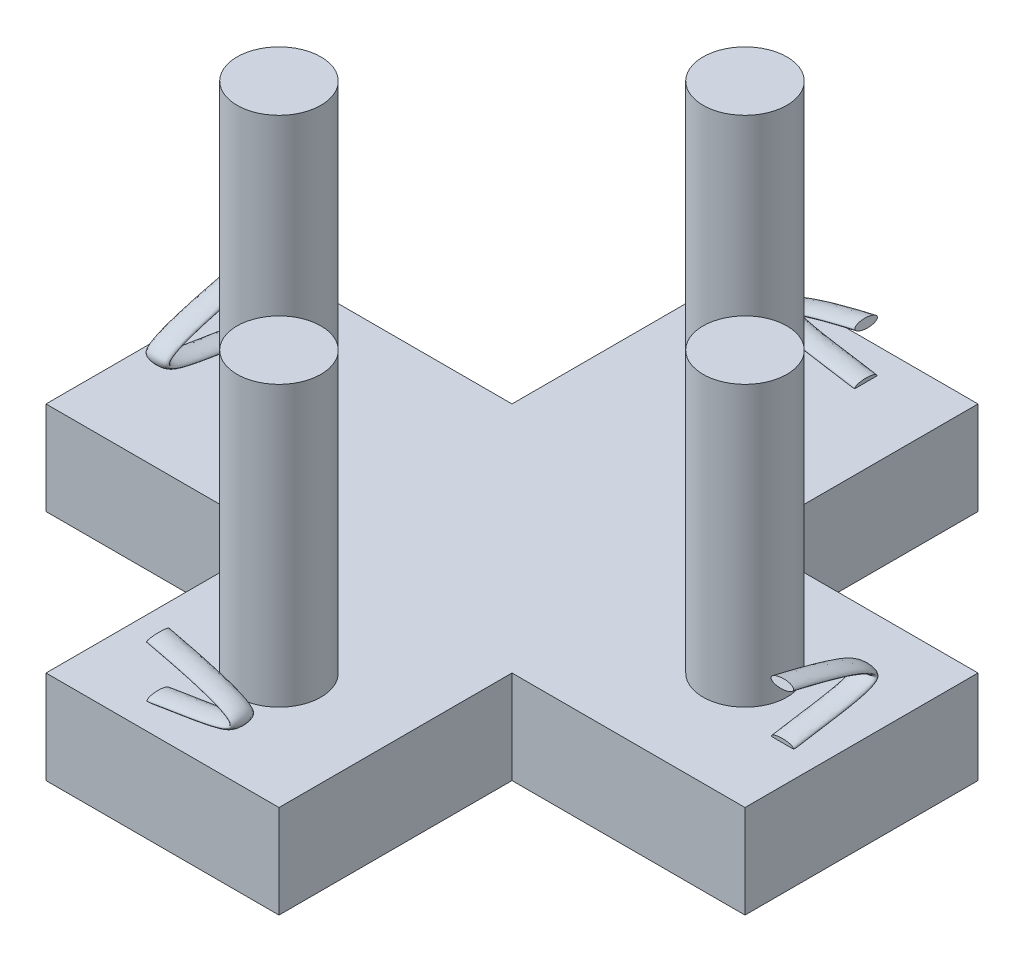
from build123d import *

# Parameters (mm, degrees)
BODY_DEPTH         = 2.54
SKETCH2_R          = 1.143
PEGS_DEPTH         = 7.62
SKETCH4_RX         = 0.3048
SKETCH4_RY         = 0.1016
MOAR_SPRINGS_COUNT = 4


with BuildPart() as part:
    # Sketch1 → body (new body)
    with BuildSketch(Plane(origin=(0, 0, 0), x_dir=(1, 0, 0), z_dir=(0, 1, 0))):
        Polygon((-8.348684361, -10.452067183), (-8.348684361, -4.102067183), (-1.998684361, -4.102067183), (-1.998684361, -10.452067183), (4.351315639, -10.452067183), (4.351315639, -16.802067183), (-1.998684361, -16.802067183), (-1.998684361, -23.152067183), (-8.348684361, -23.152067183), (-8.348684361, -16.802067183), (-14.698684361, -16.802067183), (-14.698684361, -10.452067183), align=None)
    extrude(amount=BODY_DEPTH)

    # Sketch2 → pegs (add)
    with BuildSketch(Plane(origin=(0, 2.54, 0), x_dir=(1, 0, 0), z_dir=(0, 1, 0))):
        with Locations((-5.173684361, -7.277067183)):
            Circle(SKETCH2_R)
        with Locations((1.176315639, -13.627067183)):
            Circle(SKETCH2_R)
        with Locations((-5.173684361, -19.977067183)):
            Circle(SKETCH2_R)
        with Locations((-11.523684361, -13.627067183)):
            Circle(SKETCH2_R)
    extrude(amount=PEGS_DEPTH)

    # spring: sweep along a path in Sketch3
    with BuildLine() as spring_path:  # in the path sketch's own coordinates; laid on its plane below (add() does not lay a ready-made edge on the line's plane)
        add(Edge.make_bspline(
            [(4.036923955, 2.54), (5.746860922, 2.854000963), (8.180399228, 2.978700982), (4.030684361, 3.94096251)],
            knots=[0, 0, 0, 0, 1, 1, 1, 1], degree=3))
    # Sketch4 → spring (sweep)
    with BuildSketch(Plane(origin=(-4.036923955, 0, 0), x_dir=(0, 0, -1), z_dir=(1, 0, 0))):
        with Locations((-5.118067183, 2.54)):
            Ellipse(SKETCH4_RX, SKETCH4_RY)
    spring = sweep(path=Plane(origin=(0, 0, 5.118067183), x_dir=(-1, 0, 0), z_dir=(0, 0, -1)) * spring_path.line)

    # moar springs: spring ×4 about axis
    moar_springs_axis = Axis((-5.173684361, 0, 13.627067183), (0, 1, 0))
    for i in range(1, MOAR_SPRINGS_COUNT):
        add(spring.rotate(moar_springs_axis, i * 360 / MOAR_SPRINGS_COUNT))


solid = part.part
